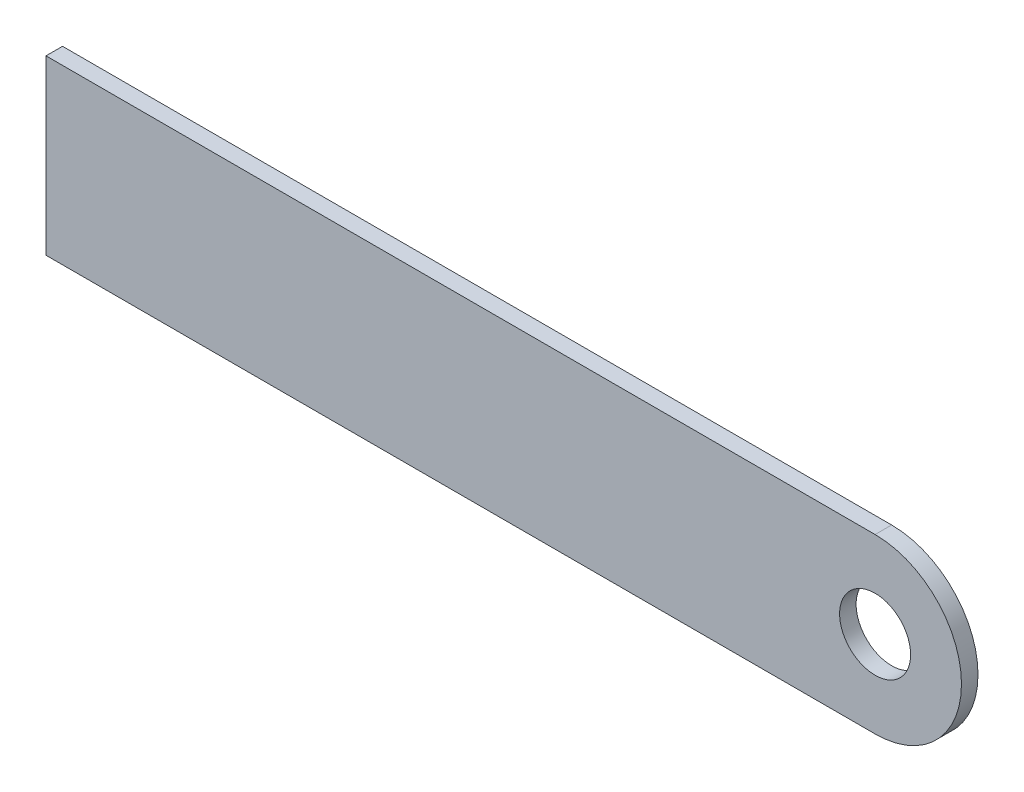
from build123d import *

# Parameters (mm, degrees)
SKETCH1_R          = 3.2639
BASE_FLANGE1_DEPTH = 1.51892


# Sheet-metal steps are written as plain solids
with BuildPart() as part:
    # Sketch1 → Base-Flange1 (new body)
    with BuildSketch(Plane.XY):
        with BuildLine():
            Line((0, 0), (76.2, 0))
            ThreePointArc((76.2, 0), (84.1375, 7.9375), (76.2, 15.875))
            Line((76.2, 15.875), (0, 15.875))
            Line((0, 15.875), (0, 0))
        make_face()
        with Locations((76.2, 7.9375)):
            Circle(SKETCH1_R, mode=Mode.SUBTRACT)
    extrude(amount=-BASE_FLANGE1_DEPTH)


solid = part.part
